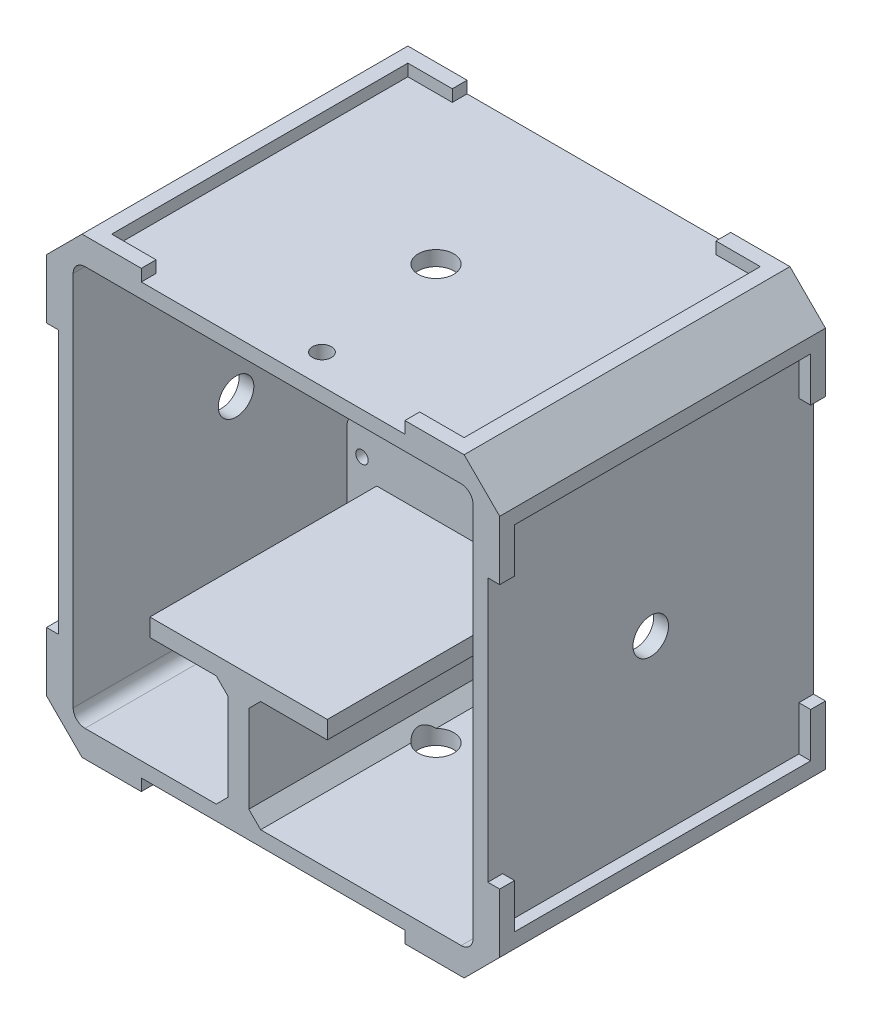
from build123d import *

# Parameters (mm, degrees)
BOSS_EXTRUDE1_DEPTH            = 55
SKETCH2_W                      = 67.5
SKETCH2_H                      = 67.5
BOSS_EXTRUDE2_DEPTH            = 2.5
CUT_EXTRUDE2_REACH             = 77.187
SKETCH4_R                      = 1.65
MIRROR2_COPY_1_REACH           = 77.187
MIRROR2_COPY_1_SKETCH_R        = 1.65
BOSS_EXTRUDE3_DEPTH            = 14.6
BOSS_EXTRUDE3_DEPTH_BACK       = 25.8
BOSS_EXTRUDE4_DEPTH            = 49.7
SKETCH7_W                      = 37.9
SKETCH7_H                      = 22.75
CUT_EXTRUDE3_DEPTH             = 8.4
BOSS_EXTRUDE7_DEPTH            = 2
CUT_EXTRUDE6_REACH             = 84.442
CUT_EXTRUDE6_DIRECTION_2_DEPTH = 83.442009922
CUT_EXTRUDE8_DEPTH             = 103.907106169
CUT_EXTRUDE8_DEPTH_BACK        = 2.5
SKETCH15_R                     = 1.6
SKETCH16_W                     = 7.5
SKETCH16_H                     = 1.65
BOSS_EXTRUDE8_DEPTH            = 7
CUT_EXTRUDE9_REACH             = 74.438
SKETCH17_R                     = 1.05
SKETCH19_R                     = 3
CUT_EXTRUDE10_DEPTH            = 2.5
BOSS_EXTRUDE9_DEPTH            = 2
CIRPATTERN1_COUNT              = 4
CIRPATTERN2_COUNT              = 4
BOSS_EXTRUDE12_DEPTH           = 55
CUT_EXTRUDE12_REACH            = 75.459
SKETCH23_W                     = 6.5
SKETCH23_H                     = 16
FILLET2_R                      = 1.5
CHAMFER1_SIZE                  = 0.75
CUT_EXTRUDE13_REACH            = 91.486
SKETCH25_W                     = 3
SKETCH25_H                     = 35
SKETCH25_W_2                   = 5
SKETCH25_H_2                   = 46.7
FILLET3_R                      = 1.5
SKETCH26_W                     = 12.543976605
SKETCH26_H                     = 9.586128164
CUT_EXTRUDE14_DEPTH            = 90.261665904
SKETCH27_W                     = 6.75
SKETCH27_H                     = 1.4
BOSS_EXTRUDE14_DEPTH           = 1.25
CHAMFER2_SIZE                  = 2
CUT_EXTRUDE15_REACH            = 85.744
SKETCH28_W                     = 7.624106446
SKETCH28_H                     = 46.373052842
SKETCH29_W                     = 40.4
SKETCH29_H                     = 3
BOSS_EXTRUDE15_DEPTH           = 18.75
SKETCH31_R                     = 4.75
BOSS_EXTRUDE16_DEPTH           = 4
CHAMFER3_SIZE                  = 0.75
CHAMFER3_OF_MIRROR3_SIZE       = 0.75
MIRROR4_START                  = 2.5
MIRROR4_OUTLINE_R              = 4.75
MIRROR4_DEPTH                  = 4


with BuildPart() as part:
    # Sketch1 → Boss-Extrude1 (new body)
    with BuildSketch(Plane.XY):
        with BuildLine():
            Line((-36.25, 32.25), (-36.25, -32.25))
            ThreePointArc((-36.25, -32.25), (-35.078427125, -35.078427125), (-32.25, -36.25))
            Line((-32.25, -36.25), (32.25, -36.25))
            ThreePointArc((32.25, -36.25), (35.078427125, -35.078427125), (36.25, -32.25))
            Line((36.25, -32.25), (36.25, 32.25))
            ThreePointArc((36.25, 32.25), (35.078427125, 35.078427125), (32.25, 36.25))
            Line((32.25, 36.25), (-32.25, 36.25))
            ThreePointArc((-32.25, 36.25), (-35.078427125, 35.078427125), (-36.25, 32.25))
        make_face()
        with BuildLine():
            Line((-31.75, 33.75), (31.75, 33.75))
            ThreePointArc((31.75, 33.75), (33.164213562, 33.164213562), (33.75, 31.75))
            Line((33.75, 31.75), (33.75, -31.75))
            ThreePointArc((33.75, -31.75), (33.164213562, -33.164213562), (31.75, -33.75))
            Line((31.75, -33.75), (-31.75, -33.75))
            ThreePointArc((-31.75, -33.75), (-33.164213562, -33.164213562), (-33.75, -31.75))
            Line((-33.75, -31.75), (-33.75, 31.75))
            ThreePointArc((-33.75, 31.75), (-33.164213562, 33.164213562), (-31.75, 33.75))
        make_face(mode=Mode.SUBTRACT)
    extrude(amount=BOSS_EXTRUDE1_DEPTH)

    # Sketch2 → Boss-Extrude2 (add)
    with BuildSketch(Plane.XY):
        Rectangle(SKETCH2_W, SKETCH2_H)
    extrude(amount=BOSS_EXTRUDE2_DEPTH)

    # Sketch4 → Cut-Extrude2 (cut, up to next)
    with BuildSketch(Plane(origin=(0, 0, 0), x_dir=(-1, 0, 0), z_dir=(0, 0, -1)), mode=Mode.PRIVATE) as cut_extrude2_sk1:
        with Locations((-28.75, 28.75)):
            Circle(SKETCH4_R)
    cut_extrude2_tool1 = extrude(cut_extrude2_sk1.sketch, amount=-CUT_EXTRUDE2_REACH, mode=Mode.PRIVATE) & part.part
    cut_extrude2 = cut_extrude2_tool1.solids().sort_by_distance((28.75, 28.75, 0))[0]
    add(cut_extrude2, mode=Mode.SUBTRACT)

    # Mirror1: Cut-Extrude2 across plane
    add(cut_extrude2.mirror(Plane(origin=(0, 0, 0), x_dir=(0, 0, 1), z_dir=(1, 0, 0))), mode=Mode.SUBTRACT)

    # Mirror2: Cut-Extrude2 across plane
    add(cut_extrude2.mirror(Plane.ZX), mode=Mode.SUBTRACT)

    # Mirror2 copy 1 sketch → Mirror2 copy 1 (cut, up to next)
    with BuildSketch(Plane(origin=(0, 0, 0), x_dir=(1, 0, 0), z_dir=(0, 0, -1)), mode=Mode.PRIVATE) as mirror2_copy_1_sk1:
        with Locations((-28.75, 28.75)):
            Circle(MIRROR2_COPY_1_SKETCH_R)
    mirror2_copy_1_tool1 = extrude(mirror2_copy_1_sk1.sketch, amount=-MIRROR2_COPY_1_REACH, mode=Mode.PRIVATE) & part.part
    add(mirror2_copy_1_tool1.solids().sort_by_distance((-28.75, -28.75, 0))[0], mode=Mode.SUBTRACT)



with BuildPart() as body_2:
    # Sketch5 → Boss-Extrude3 (new, two sides: drawn at the far end of the back side and taken through both)
    with BuildSketch(Plane(origin=(0, 0, 0), x_dir=(0, 0, -1), z_dir=(1, 0, 0)).offset(-BOSS_EXTRUDE3_DEPTH_BACK)):
        Polygon((-16.7, 12), (-16.7, -12), (-60.4, -12), (-63.4, -12), (-63.4, -15), (-13.7, -15), (-13.7, 12), align=None)
    extrude(amount=BOSS_EXTRUDE3_DEPTH + BOSS_EXTRUDE3_DEPTH_BACK)


with BuildPart() as part_1:
    add(part.part)

    add(body_2.part)  # Boss-Extrude4 merges body 2
    # Sketch6 → Boss-Extrude4 (add)
    with BuildSketch(Plane.XY.offset(63.4)):
        Polygon((-25.8, -12), (12.1, -12), (12.1, -15), (-4.1, -15), (-4.1, -33.75), (12.1, -33.75), (12.1, -36.25), (-25.8, -36.25), (-25.8, -33.75), (-7.6, -33.75), (-7.6, -15), (-25.8, -15), align=None)
    extrude(amount=-BOSS_EXTRUDE4_DEPTH)

    # Sketch7 → Cut-Extrude3 (cut)
    with BuildSketch(Plane.XY.offset(63.4)):
        with Locations((-6.85, -24.875)):
            Rectangle(SKETCH7_W, SKETCH7_H)
    extrude(amount=-CUT_EXTRUDE3_DEPTH, mode=Mode.SUBTRACT)

    # Sketch12 → Boss-Extrude7 (add)
    with BuildSketch(Plane(origin=(0, 36.25, 0), x_dir=(1, 0, 0), z_dir=(0, 1, 0))):
        Polygon((29.75, -55), (32.25, -55), (32.25, -52.5), (32.25, -45), (29.75, -45), (29.75, -52.5), (22.25, -52.5), (22.25, -55), align=None)
        Polygon((-32.25, 0), (-32.25, -10), (-29.75, -10), (-29.75, -2.5), (-22.25, -2.5), (-22.25, 0), align=None)
    boss_extrude7 = extrude(amount=BOSS_EXTRUDE7_DEPTH)

    # Sketch13 → Cut-Extrude6 (cut, up to next)
    with BuildSketch(Plane(origin=(0, 0, 0), x_dir=(-1, 0, 0), z_dir=(0, 0, -1)), mode=Mode.PRIVATE) as cut_extrude6_sk1:
        with BuildLine():
            Line((-33.75, 21.25), (-25.25, 21.25))
            ThreePointArc((-25.25, 21.25), (-22.421572875, 22.421572875), (-21.25, 25.25))
            Line((-21.25, 25.25), (-21.25, 33.75))
            Line((-21.25, 33.75), (21.25, 33.75))
            Line((21.25, 33.75), (21.25, 25.25))
            ThreePointArc((21.25, 25.25), (22.421572875, 22.421572875), (25.25, 21.25))
            Line((25.25, 21.25), (33.75, 21.25))
            Line((33.75, 21.25), (33.75, -21.25))
            Line((33.75, -21.25), (25.25, -21.25))
            ThreePointArc((25.25, -21.25), (22.421572875, -22.421572875), (21.25, -25.25))
            Line((21.25, -25.25), (21.25, -33.75))
            Line((21.25, -33.75), (-21.25, -33.75))
            Line((-21.25, -33.75), (-21.25, -25.25))
            ThreePointArc((-21.25, -25.25), (-22.421572875, -22.421572875), (-25.25, -21.25))
            Line((-25.25, -21.25), (-33.75, -21.25))
            Line((-33.75, -21.25), (-33.75, 21.25))
        make_face()
    cut_extrude6_tool1 = extrude(cut_extrude6_sk1.sketch, amount=-CUT_EXTRUDE6_REACH, mode=Mode.PRIVATE) & part_1.part
    add(cut_extrude6_tool1.solids().sort_by_distance((0, 0, 0))[0], mode=Mode.SUBTRACT)

    # Sketch13 → Cut-Extrude6 direction 2 (cut)
    with BuildSketch(Plane(origin=(0, 0, 0), x_dir=(-1, 0, 0), z_dir=(0, 0, -1))):
        with BuildLine():
            Line((-33.75, 21.25), (-25.25, 21.25))
            ThreePointArc((-25.25, 21.25), (-22.421572875, 22.421572875), (-21.25, 25.25))
            Line((-21.25, 25.25), (-21.25, 33.75))
            Line((-21.25, 33.75), (21.25, 33.75))
            Line((21.25, 33.75), (21.25, 25.25))
            ThreePointArc((21.25, 25.25), (22.421572875, 22.421572875), (25.25, 21.25))
            Line((25.25, 21.25), (33.75, 21.25))
            Line((33.75, 21.25), (33.75, -21.25))
            Line((33.75, -21.25), (25.25, -21.25))
            ThreePointArc((25.25, -21.25), (22.421572875, -22.421572875), (21.25, -25.25))
            Line((21.25, -25.25), (21.25, -33.75))
            Line((21.25, -33.75), (-21.25, -33.75))
            Line((-21.25, -33.75), (-21.25, -25.25))
            ThreePointArc((-21.25, -25.25), (-22.421572875, -22.421572875), (-25.25, -21.25))
            Line((-25.25, -21.25), (-33.75, -21.25))
            Line((-33.75, -21.25), (-33.75, 21.25))
        make_face()
    extrude(amount=CUT_EXTRUDE6_DIRECTION_2_DEPTH, mode=Mode.SUBTRACT)

    # Sketch15 → Cut-Extrude8 (cut, two sides: drawn at the far end of the back side and taken through both)
    with BuildSketch(Plane(origin=(0, 36.25, 0), x_dir=(1, 0, 0), z_dir=(0, 1, 0)).offset(-CUT_EXTRUDE8_DEPTH_BACK)):
        with Locations(Location((3.25, -50, 0), (0, 0, 270))):
            Circle(SKETCH15_R)
    extrude(amount=CUT_EXTRUDE8_DEPTH + CUT_EXTRUDE8_DEPTH_BACK, mode=Mode.SUBTRACT)

    # Sketch16 → Boss-Extrude8 (add)
    with BuildSketch(Plane(origin=(-33.75, 0, 0), x_dir=(0, 0, -1), z_dir=(1, 0, 0))):
        with Locations((-16.5, 29.525)):
            Rectangle(SKETCH16_W, SKETCH16_H)
    extrude(amount=BOSS_EXTRUDE8_DEPTH)

    # Sketch17 → Cut-Extrude9 (cut, up to next)
    with BuildSketch(Plane(origin=(0, 0, 13.7), x_dir=(-1, 0, 0), z_dir=(0, 0, -1)), mode=Mode.PRIVATE) as cut_extrude9_sk1:
        with Locations(Location((-12.1, 9, 0), (0, 0, 90))):
            Circle(SKETCH17_R)
    cut_extrude9_tool1 = extrude(cut_extrude9_sk1.sketch, amount=-CUT_EXTRUDE9_REACH, mode=Mode.PRIVATE) & part_1.part
    # Sketch17 → Cut-Extrude9 (cut, up to next)
    with BuildSketch(Plane(origin=(0, 0, 13.7), x_dir=(-1, 0, 0), z_dir=(0, 0, -1)), mode=Mode.PRIVATE) as cut_extrude9_sk2:
        with Locations(Location((-12.1, -9, 0), (0, 0, 90))):
            Circle(SKETCH17_R)
    cut_extrude9_tool2 = extrude(cut_extrude9_sk2.sketch, amount=-CUT_EXTRUDE9_REACH, mode=Mode.PRIVATE) & part_1.part
    # Sketch17 → Cut-Extrude9 (cut, up to next)
    with BuildSketch(Plane(origin=(0, 0, 13.7), x_dir=(-1, 0, 0), z_dir=(0, 0, -1)), mode=Mode.PRIVATE) as cut_extrude9_sk3:
        with Locations(Location((23.3, -9, 0), (0, 0, 90))):
            Circle(SKETCH17_R)
    cut_extrude9_tool3 = extrude(cut_extrude9_sk3.sketch, amount=-CUT_EXTRUDE9_REACH, mode=Mode.PRIVATE) & part_1.part
    add(cut_extrude9_tool1.solids().sort_by_distance((12.1, 9, 13.7))[0], mode=Mode.SUBTRACT)
    add(cut_extrude9_tool2.solids().sort_by_distance((12.1, -9, 13.7))[0], mode=Mode.SUBTRACT)
    add(cut_extrude9_tool3.solids().sort_by_distance((-23.3, -9, 13.7))[0], mode=Mode.SUBTRACT)

    # Sketch19 → Cut-Extrude10 (cut)
    with BuildSketch(Plane(origin=(0, 36.25, 0), x_dir=(1, 0, 0), z_dir=(0, 1, 0))):
        with Locations(Location((0, -27.5, 0), (0, 0, 270))):
            Circle(SKETCH19_R)
    cut_extrude10 = extrude(amount=-CUT_EXTRUDE10_DEPTH, mode=Mode.SUBTRACT)

    # Sketch20 → Boss-Extrude9 (add)
    with BuildSketch(Plane(origin=(36.25, 0, -36.25), x_dir=(0, 0, 1), z_dir=(-1, 0, 0))):
        Polygon((91.25, 32.25), (81.25, 32.25), (81.25, 29.75), (88.75, 29.75), (88.75, 22.25), (91.25, 22.25), align=None)
        Polygon((36.25, -22.25), (36.25, -32.25), (46.25, -32.25), (46.25, -29.75), (38.75, -29.75), (38.75, -22.25), align=None)
    boss_extrude9 = extrude(amount=-BOSS_EXTRUDE9_DEPTH)

    # CirPattern1: Boss-Extrude7, Cut-Extrude10 ×4 about axis
    cirpattern1_axis = Axis((0, 0, 0), (0, 0, 1))
    add([boss_extrude7.rotate(cirpattern1_axis, i * 360 / CIRPATTERN1_COUNT) for i in range(1, CIRPATTERN1_COUNT)])
    add([cut_extrude10.rotate(cirpattern1_axis, i * 360 / CIRPATTERN1_COUNT) for i in range(1, CIRPATTERN1_COUNT)], mode=Mode.SUBTRACT)

    # CirPattern2: Boss-Extrude9 ×4 about axis
    cirpattern2_axis = Axis((0, 0, 0), (0, 0, 1))
    for i in range(1, CIRPATTERN2_COUNT):
        add(boss_extrude9.rotate(cirpattern2_axis, i * 360 / CIRPATTERN2_COUNT))

    # Sketch22 → Boss-Extrude12 (add, through all)
    with BuildSketch(Plane.XY.offset(55)):
        Polygon((-38.25, 32.25), (-32.25, 38.25), (-29.75, 38.25), (-29.75, 33.75), (-33.75, 33.75), (-33.75, 29.75), (-38.25, 29.75), align=None)
        Polygon((33.75, 33.75), (33.75, 29.75), (38.25, 29.75), (38.25, 32.25), (32.25, 38.25), (29.75, 38.25), (29.75, 33.75), align=None)
        Polygon((38.25, -32.25), (32.25, -38.25), (29.75, -38.25), (29.75, -33.75), (33.75, -33.75), (33.75, -29.75), (38.25, -29.75), align=None)
        Polygon((-33.75, -33.75), (-33.75, -29.75), (-38.25, -29.75), (-38.25, -32.25), (-32.25, -38.25), (-29.75, -38.25), (-29.75, -33.75), align=None)
    extrude(amount=-BOSS_EXTRUDE12_DEPTH)

    # Sketch23 → Cut-Extrude12 (cut, up to next)
    with BuildSketch(Plane(origin=(0, 0, 13.7), x_dir=(-1, 0, 0), z_dir=(0, 0, -1)), mode=Mode.PRIVATE) as cut_extrude12_sk1:
        with Locations((22.55, 4)):
            Rectangle(SKETCH23_W, SKETCH23_H)
    cut_extrude12_tool1 = extrude(cut_extrude12_sk1.sketch, amount=-CUT_EXTRUDE12_REACH, mode=Mode.PRIVATE) & part_1.part
    add(cut_extrude12_tool1.solids().sort_by_distance((-22.55, 4, 13.7))[0], mode=Mode.SUBTRACT)

    # Fillet2
    fillet2_edges = [part_1.edges().sort_by_distance(p)[0] for p in [
        (14.6, 12, 15.2),
    ]]
    fillet(fillet2_edges, radius=FILLET2_R)

    # Chamfer1
    chamfer1_edges = [part_1.edges().sort_by_distance(p)[0] for p in [
        (-33.75, 28.7, 16.5),
        (-30.25, 30.35, 20.25),
        (-26.75, 30.35, 16.5),
    ]]
    chamfer(chamfer1_edges, length=CHAMFER1_SIZE)

    # Sketch25 → Cut-Extrude13 (cut, up to next)
    with BuildSketch(Plane(origin=(0, -12, 0), x_dir=(1, 0, 0), z_dir=(0, 1, 0)), mode=Mode.PRIVATE) as cut_extrude13_sk1:
        with Locations((13.1, -45.9)):
            Rectangle(SKETCH25_W, SKETCH25_H)
    cut_extrude13_tool1 = extrude(cut_extrude13_sk1.sketch, amount=-CUT_EXTRUDE13_REACH, mode=Mode.PRIVATE) & part_1.part
    # Sketch25 → Cut-Extrude13 (cut, up to next)
    with BuildSketch(Plane(origin=(0, -12, 0), x_dir=(1, 0, 0), z_dir=(0, 1, 0)), mode=Mode.PRIVATE) as cut_extrude13_sk2:
        with Locations((-23.3, -40.05)):
            Rectangle(SKETCH25_W_2, SKETCH25_H_2)
    cut_extrude13_tool2 = extrude(cut_extrude13_sk2.sketch, amount=-CUT_EXTRUDE13_REACH, mode=Mode.PRIVATE) & part_1.part
    add(cut_extrude13_tool1.solids().sort_by_distance((13.1, -12, 45.9))[0], mode=Mode.SUBTRACT)
    add(cut_extrude13_tool2.solids().sort_by_distance((-23.3, -12, 40.05))[0], mode=Mode.SUBTRACT)

    # Fillet3
    fillet3_edges = [part_1.edges().sort_by_distance(p)[0] for p in [
        (-19.3, -4, 15.2),
        (-19.3, 12, 15.2),
        (-25.8, -4, 15.2),
    ]]
    fillet(fillet3_edges, radius=FILLET3_R)

    # Sketch26 → Cut-Extrude14 (cut, through all)
    with BuildSketch(Plane(origin=(11.6, 0, 0), x_dir=(0, 0, -1), z_dir=(1, 0, 0))):
        with Locations((-61.271988302, -13.249120227)):
            Rectangle(SKETCH26_W, SKETCH26_H)
    extrude(amount=-CUT_EXTRUDE14_DEPTH, mode=Mode.SUBTRACT)

    # Sketch27 → Boss-Extrude14 (add)
    with BuildSketch(Plane(origin=(-33.75, 0, 0), x_dir=(0, 0, -1), z_dir=(1, 0, 0))):
        with Locations((-16.125, 31.05)):
            Rectangle(SKETCH27_W, SKETCH27_H)
    extrude(amount=BOSS_EXTRUDE14_DEPTH)

    # Chamfer2
    # the kernel refuses this chamfer: 2 mm, written as the material it adds along each edge
    with BuildSketch(Plane(origin=(-4.1, -33.75, 13.7), x_dir=(1, 0, 0), z_dir=(0, 0, 1))) as chamfer2_piece_1_section:
        Polygon((CHAMFER2_SIZE, 0), (0, CHAMFER2_SIZE), (0, 0), align=None)
    chamfer2_piece_1 = extrude(amount=41.3, mode=Mode.PRIVATE)
    chamfer2_piece_1 = chamfer2_piece_1 - Plane(origin=(0, -33.75, 27.5), x_dir=(0, 0, 1), z_dir=(0, -1, 0)) * Cylinder(3, 91, mode=Mode.PRIVATE)
    add(chamfer2_piece_1)
    with BuildSketch(Plane(origin=(-4.1, -15, 55), x_dir=(0, -1, 0), z_dir=(0, 0, -1)), Plane(origin=(-7.6, -33.75, 55), x_dir=(0, 1, 0), z_dir=(0, 0, -1))) as chamfer2_piece_2:
        Polygon((CHAMFER2_SIZE, 0), (0, -CHAMFER2_SIZE), (0, 0), align=None)
    extrude(amount=41.3)
    with BuildSketch(Plane(origin=(-7.6, -15, 55), x_dir=(0, -1, 0), z_dir=(0, 0, -1))) as chamfer2_piece_3:
        Polygon((CHAMFER2_SIZE, 0), (0, CHAMFER2_SIZE), (0, 0), align=None)
    extrude(amount=41.3)

    # Sketch28 → Cut-Extrude15 (cut, up to next)
    with BuildSketch(Plane(origin=(0, -12, 0), x_dir=(1, 0, 0), z_dir=(0, 1, 0)), mode=Mode.PRIVATE) as cut_extrude15_sk1:
        with Locations((12.962053223, -39.886526421)):
            Rectangle(SKETCH28_W, SKETCH28_H)
    cut_extrude15_tool1 = extrude(cut_extrude15_sk1.sketch, amount=-CUT_EXTRUDE15_REACH, mode=Mode.PRIVATE) & part_1.part
    add(cut_extrude15_tool1.solids().sort_by_distance((12.962053, -12, 39.886526))[0], mode=Mode.SUBTRACT)

    # Sketch29 → Boss-Extrude15 (add)
    with BuildSketch(Plane(origin=(0, -15, 0), x_dir=(-1, 0, 0), z_dir=(0, -1, 0))):
        with Locations((5.6, -15.2)):
            Rectangle(SKETCH29_W, SKETCH29_H)
    extrude(amount=BOSS_EXTRUDE15_DEPTH)

    # Sketch31 → Boss-Extrude16 (add)
    with BuildSketch(Plane.XY.offset(2.5)):
        with Locations((-28.75, 28.75)):
            Circle(SKETCH31_R)
        Polygon((-28.75, 32.069764048), (-31.625, 30.409882024), (-31.625, 27.090117976), (-28.75, 25.430235952), (-25.875, 27.090117976), (-25.875, 30.409882024), align=None, mode=Mode.SUBTRACT)
    boss_extrude16 = extrude(amount=BOSS_EXTRUDE16_DEPTH)

    # Chamfer3
    chamfer3_edges = [part_1.edges().sort_by_distance(p)[0] for p in [
        (-27.3125, 31.239823036, 6.5),
        (-30.1875, 31.239823036, 6.5),
        (-31.625, 28.75, 6.5),
        (-30.1875, 26.260176964, 6.5),
        (-27.3125, 26.260176964, 6.5),
        (-25.875, 28.75, 6.5),
    ]]
    chamfer(chamfer3_edges, length=CHAMFER3_SIZE)

    # Mirror3: Boss-Extrude16 across plane
    add(boss_extrude16.mirror(Plane(origin=(0, 0, 0), x_dir=(0, 0, 1), z_dir=(1, 0, 0))))

    # Chamfer3 of Mirror3
    chamfer3_of_mirror3_edges = [part_1.edges().sort_by_distance(p)[0] for p in [
        (27.3125, 31.239823036, 6.5),
        (30.1875, 31.239823036, 6.5),
        (31.625, 28.75, 6.5),
        (30.1875, 26.260176964, 6.5),
        (27.3125, 26.260176964, 6.5),
        (25.875, 28.75, 6.5),
    ]]
    chamfer(chamfer3_of_mirror3_edges, length=CHAMFER3_OF_MIRROR3_SIZE)

    # Mirror4: read off the stored shape, not the designer's step
    # Mirror4 outline → Mirror4 (add)
    # profile 1 of 2: a face of its own
    with BuildSketch(Plane.XY.offset(MIRROR4_START)):
        with Locations((28.75, -28.75)):
            Circle(MIRROR4_OUTLINE_R)
        Polygon((28.75, -32.069764048), (25.875, -30.409882024), (25.875, -27.090117976), (28.75, -25.430235952), (31.625, -27.090117976), (31.625, -30.409882024), align=None, mode=Mode.SUBTRACT)
    # profile 2 of 2: a face of its own
    with BuildSketch(Plane.XY.offset(MIRROR4_START)):
        with Locations((-28.75, -28.75)):
            Circle(MIRROR4_OUTLINE_R)
        Polygon((-31.625, -30.409882024), (-31.625, -27.090117976), (-28.75, -25.430235952), (-25.875, -27.090117976), (-25.875, -30.409882024), (-28.75, -32.069764048), align=None, mode=Mode.SUBTRACT)
    extrude(amount=MIRROR4_DEPTH)

    # Mirror4 2: loft between two sections, ruled curve by curve
    mirror4_2_from = [
        Edge.make_line((-25.875, -27.090117976, 5.75), (-25.875, -30.409882024, 5.75)),
        Edge.make_line((-31.625, -30.409882024, 5.75), (-31.625, -27.090117976, 5.75)),
        Edge.make_line((-25.875, -30.409882024, 5.75), (-28.75, -32.069764048, 5.75)),
        Edge.make_line((-25.875, -27.090117976, 5.75), (-28.75, -25.430235952, 5.75)),
        Edge.make_line((-28.75, -32.069764048, 5.75), (-31.625, -30.409882024, 5.75)),
        Edge.make_line((-28.75, -25.430235952, 5.75), (-31.625, -27.090117976, 5.75)),
    ]
    mirror4_2_to = [
        Edge.make_line((-25.125, -26.657105274, 6.5), (-25.125, -30.842894726, 6.5)),
        Edge.make_line((-32.375, -30.842894726, 6.5), (-32.375, -26.657105274, 6.5)),
        Edge.make_line((-25.125, -30.842894726, 6.5), (-28.75, -32.935789452, 6.5)),
        Edge.make_line((-25.125, -26.657105274, 6.5), (-28.75, -24.564210548, 6.5)),
        Edge.make_line((-28.75, -32.935789452, 6.5), (-32.375, -30.842894726, 6.5)),
        Edge.make_line((-28.75, -24.564210548, 6.5), (-32.375, -26.657105274, 6.5)),
    ]
    mirror4_2 = Solid(Shell([*[Face.make_surface_from_curves(mirror4_2_from[k], mirror4_2_to[k]) for k in range(6)], Face(Wire(mirror4_2_from)), Face(Wire(mirror4_2_to))]))
    add(mirror4_2, mode=Mode.SUBTRACT)

    # Mirror4 3: loft between two sections, ruled curve by curve
    mirror4_3_from = [
        Edge.make_line((25.875, -27.090117976, 5.75), (25.875, -30.409882024, 5.75)),
        Edge.make_line((31.625, -30.409882024, 5.75), (31.625, -27.090117976, 5.75)),
        Edge.make_line((25.875, -30.409882024, 5.75), (28.75, -32.069764048, 5.75)),
        Edge.make_line((25.875, -27.090117976, 5.75), (28.75, -25.430235952, 5.75)),
        Edge.make_line((28.75, -32.069764048, 5.75), (31.625, -30.409882024, 5.75)),
        Edge.make_line((28.75, -25.430235952, 5.75), (31.625, -27.090117976, 5.75)),
    ]
    mirror4_3_to = [
        Edge.make_line((25.125, -26.657105274, 6.5), (25.125, -30.842894726, 6.5)),
        Edge.make_line((32.375, -30.842894726, 6.5), (32.375, -26.657105274, 6.5)),
        Edge.make_line((25.125, -30.842894726, 6.5), (28.75, -32.935789452, 6.5)),
        Edge.make_line((25.125, -26.657105274, 6.5), (28.75, -24.564210548, 6.5)),
        Edge.make_line((28.75, -32.935789452, 6.5), (32.375, -30.842894726, 6.5)),
        Edge.make_line((28.75, -24.564210548, 6.5), (32.375, -26.657105274, 6.5)),
    ]
    mirror4_3 = Solid(Shell([*[Face.make_surface_from_curves(mirror4_3_from[k], mirror4_3_to[k]) for k in range(6)], Face(Wire(mirror4_3_from)), Face(Wire(mirror4_3_to))]))
    add(mirror4_3, mode=Mode.SUBTRACT)


solid = part_1.part
